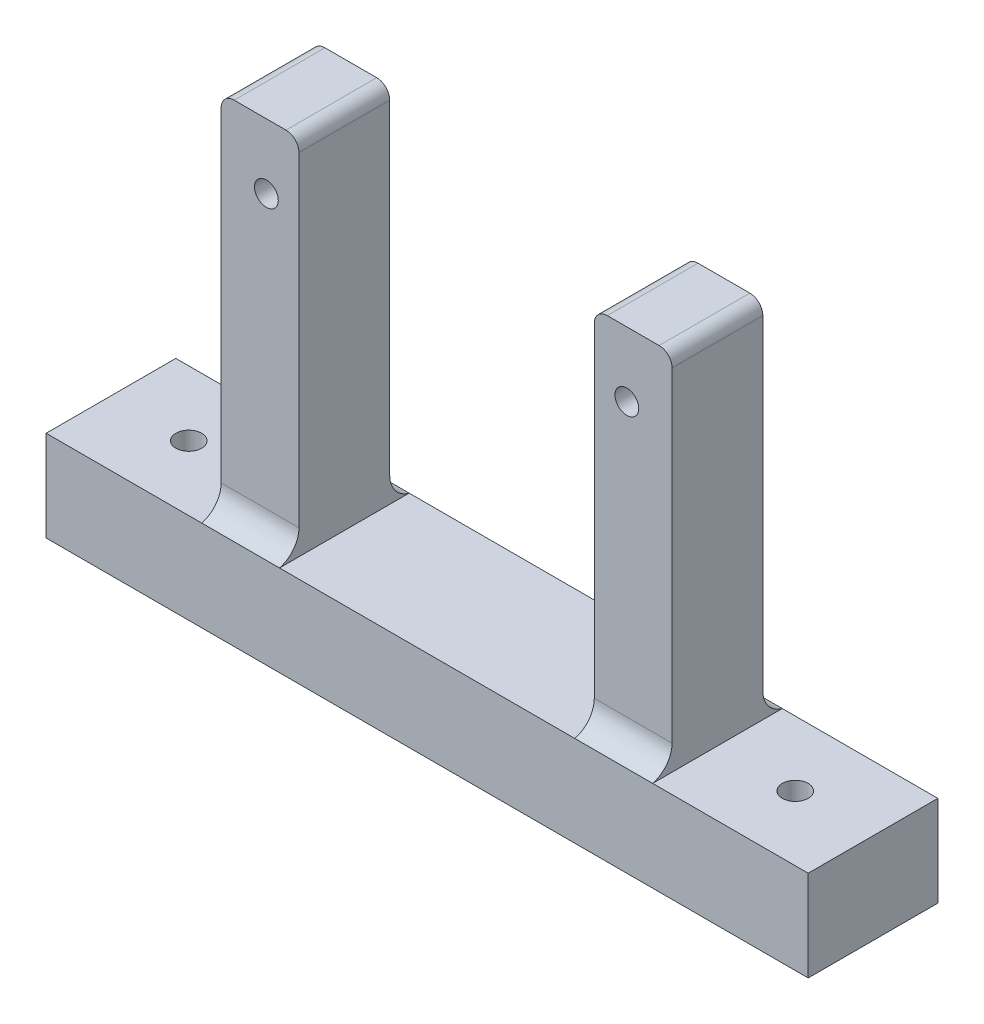
from build123d import *

# Parameters (mm, degrees)
SKETCH1_W         = 58.78
SKETCH1_H         = 10
BASE_DEPTH        = 7
SKETCH4_W         = 6
SKETCH4_H         = 35
SKETCH4_R         = 0.915
FLANGE_DEPTH      = 3.5
HOLE_R            = 1
BOTTOM_HOLE_DEPTH = 7
BOTTOM_FILLET_R   = 2
TOP_FILLET_R      = 1


with BuildPart() as part:
    # Sketch1 → Base (new body)
    with BuildSketch(Plane(origin=(0, 0, 0), x_dir=(1, 0, 0), z_dir=(0, 1, 0))):
        Rectangle(SKETCH1_W, SKETCH1_H)
    extrude(amount=BASE_DEPTH)

    # Sketch4 → Flange (add, symmetric)
    # profile 1 of 2: a face of its own
    with BuildSketch(Plane.XY):
        with Locations((-14.39, 17.5)):
            Rectangle(SKETCH4_W, SKETCH4_H)
        with Locations((-13.9, 30)):
            Circle(SKETCH4_R, mode=Mode.SUBTRACT)
    # profile 2 of 2: a face of its own
    with BuildSketch(Plane.XY):
        with Locations((14.39, 17.5)):
            Rectangle(SKETCH4_W, SKETCH4_H)
        with Locations((13.9, 30)):
            Circle(SKETCH4_R, mode=Mode.SUBTRACT)
    extrude(amount=FLANGE_DEPTH, both=True)

    # Hole → Bottom Hole (cut)
    with BuildSketch(Plane(origin=(0, 7, 0), x_dir=(1, 0, 0), z_dir=(0, 1, 0))):
        with Locations(Location((-23.39, 0, 0), (0, 0, 270))):
            Circle(HOLE_R)
        with Locations(Location((23.39, 0, 0), (0, 0, 270))):
            Circle(HOLE_R)
    extrude(amount=-BOTTOM_HOLE_DEPTH, mode=Mode.SUBTRACT)

    # Bottom Fillet
    # the kernel refuses this fillet: 2 mm, written as the material it adds along each edge
    with BuildSketch(Plane(origin=(-11.39, 7, -3.5), x_dir=(0, 0, -1), z_dir=(-1, 0, 0)), Plane(origin=(11.39, 7, 3.5), x_dir=(0, 0, 1), z_dir=(1, 0, 0))) as bottom_fillet_piece_1:
        with BuildLine():
            CenterArc((2, -1.936491673), BOTTOM_FILLET_R, 104.477512186, 75.522487814)
            Line((0, -1.936491673), (-0.04, -1.936491673))
            Line((-0.04, -1.936491673), (-0.04, 0))
            Line((-0.04, 0), (0, 0.04))
            ThreePointArc((0, 0.04), (0.75, 0.04), (1.49, 0.038729833))
            Line((1.49, 0.038729833), (1.5, 0))
        make_face()
    extrude(amount=6)
    with BuildSketch(Plane(origin=(-11.39, 7, 3.5), x_dir=(0, 0, 1), z_dir=(-1, 0, 0)), Plane(origin=(11.39, 7, -3.5), x_dir=(0, 0, -1), z_dir=(1, 0, 0))) as bottom_fillet_piece_2:
        with BuildLine():
            CenterArc((2, 1.936491673), BOTTOM_FILLET_R, 180, 75.522487814)
            Line((0, 1.936491673), (-0.04, 1.936491673))
            Line((-0.04, 1.936491673), (-0.04, 0))
            Line((-0.04, 0), (0, -0.04))
            ThreePointArc((0, -0.04), (0.75, -0.04), (1.49, -0.038729833))
            Line((1.49, -0.038729833), (1.5, 0))
        make_face()
    extrude(amount=6)

    # Top Fillet
    top_fillet_edges = [part.edges().sort_by_distance(p)[0] for p in [
        (-17.39, 35, 0),
        (-11.39, 35, 0),
        (11.39, 35, 0),
        (17.39, 35, 0),
    ]]
    fillet(top_fillet_edges, radius=TOP_FILLET_R)


solid = part.part
